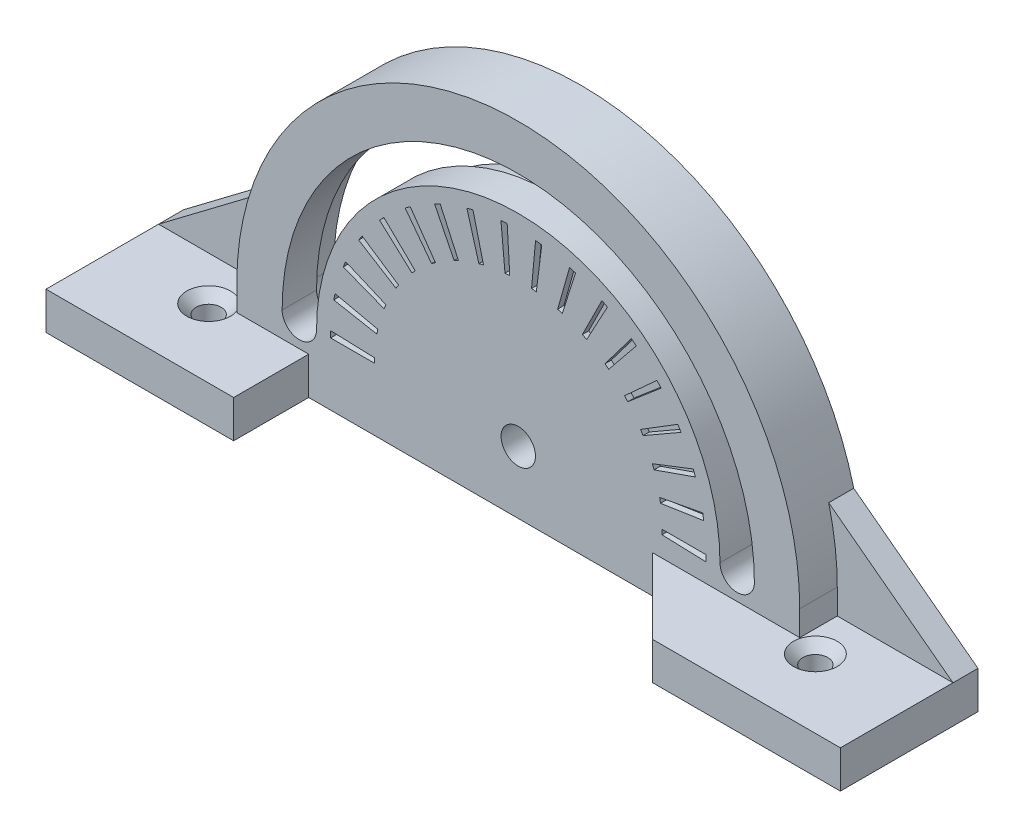
from build123d import *

# Parameters (mm, degrees)
SKETCH1_R                = 2.75
BOSS_EXTRUDE1_DEPTH      = 10
CUT_EXTRUDE1_DEPTH       = 4.5
CUT_EXTRUDE2_DEPTH       = 1
CIRPATTERN1_COUNT        = 18
CIRPATTERN1_ANGLE        = 180
SKETCH4_W                = 30
SKETCH4_H                = 22
SKETCH4_R                = 2
BOSS_EXTRUDE2_DEPTH      = 6
CHAMFER3_SIZE            = 12
BOSS_EXTRUDE3_DEPTH      = 4
CHAMFER4_SIZE            = 1.5
CHAMFER4_OF_MIRROR1_SIZE = 1.5


with BuildPart() as part:
    # Sketch1 → Boss-Extrude1 (new body)
    with BuildSketch(Plane.XY):
        with BuildLine():
            Line((-45, 0), (-45, -10))
            Line((-45, -10), (45, -10))
            Line((45, -10), (45, 0))
            ThreePointArc((45, 0), (0, 45), (-45, 0))
        make_face()
        Circle(SKETCH1_R, mode=Mode.SUBTRACT)
        with BuildLine():
            ThreePointArc((-32.25, 0), (0, 32.25), (32.25, 0))
            ThreePointArc((32.25, 0), (35, -2.75), (37.75, 0))
            ThreePointArc((37.75, 0), (0, 37.75), (-37.75, 0))
            ThreePointArc((-37.75, 0), (-35, -2.75), (-32.25, 0))
        make_face(mode=Mode.SUBTRACT)
    extrude(amount=BOSS_EXTRUDE1_DEPTH)

    # Sketch2 → Cut-Extrude1 (cut)
    with BuildSketch(Plane(origin=(0, 0, 0), x_dir=(-1, 0, 0), z_dir=(0, 0, -1))):
        Polygon((4.907477288, 0), (2.453738644, -4.25), (-2.453738644, -4.25), (-4.907477288, 0), (-2.453738644, 4.25), (2.453738644, 4.25), align=None)
        with BuildLine():
            ThreePointArc((-30.5, 0), (0, 30.5), (30.5, 0))
            ThreePointArc((30.5, 0), (35, -4.5), (39.5, 0))
            ThreePointArc((39.5, 0), (0, 39.5), (-39.5, 0))
            ThreePointArc((-39.5, 0), (-35, -4.5), (-30.5, 0))
        make_face()
    extrude(amount=-CUT_EXTRUDE1_DEPTH, mode=Mode.SUBTRACT)

    # Sketch3 → Cut-Extrude2 (cut)
    with BuildSketch(Plane.XY.offset(10)):
        with BuildLine():
            Line((-29.983333333, 0.999861101), (-22.987222222, 0.766560178))
            ThreePointArc((-22.987222222, 0.766560178), (-22.996805334, 0.383333333), (-23, 0))
            Line((-23, 0), (-30, 0))
            ThreePointArc((-30, 0), (-29.995833044, 0.5), (-29.983333333, 0.999861101))
        make_face()
    cut_extrude2 = extrude(amount=-CUT_EXTRUDE2_DEPTH, mode=Mode.SUBTRACT)

    # CirPattern1: Cut-Extrude2 ×18 about axis
    cirpattern1_axis = Axis((0, 0, 0), (0, 0, -1))
    for i in range(1, CIRPATTERN1_COUNT):
        add(cut_extrude2.rotate(cirpattern1_axis, i * CIRPATTERN1_ANGLE / (CIRPATTERN1_COUNT - 1)), mode=Mode.SUBTRACT)

    # Sketch4 → Boss-Extrude2 (add)
    with BuildSketch(Plane.XZ.offset(10)):
        with Locations((48.5, 11)):
            Rectangle(SKETCH4_W, SKETCH4_H)
        with Locations(Location((48.5, 11, 0), (0, 0, 270))):
            Circle(SKETCH4_R, mode=Mode.SUBTRACT)
    boss_extrude2 = extrude(amount=-BOSS_EXTRUDE2_DEPTH)

    # Chamfer3
    chamfer3_edges = [part.edges().sort_by_distance(p)[0] for p in [
        (33.5, -7, 10),
    ]]
    chamfer(chamfer3_edges, length=CHAMFER3_SIZE - 0.0001)  # a hair under: the kernel refuses the full size

    # Sketch5 → Boss-Extrude3 (add)
    with BuildSketch(Plane(origin=(0, 0, 0), x_dir=(-1, 0, 0), z_dir=(0, 0, -1))):
        Polygon((-63.5, -4), (-43.634848459, 11), (-43.634848459, -4), align=None)
    boss_extrude3 = extrude(amount=-BOSS_EXTRUDE3_DEPTH)

    # Chamfer4
    chamfer4_edges = [part.edges().sort_by_distance(p)[0] for p in [
        (48.5, -4, 13),
    ]]
    chamfer(chamfer4_edges, length=CHAMFER4_SIZE)

    # Mirror1: Boss-Extrude2, Boss-Extrude3 across plane
    add(boss_extrude2.mirror(Plane(origin=(0, 0, 0), x_dir=(0, 0, 1), z_dir=(1, 0, 0))))
    add(boss_extrude3.mirror(Plane(origin=(0, 0, 0), x_dir=(0, 0, 1), z_dir=(1, 0, 0))))

    # Chamfer4 of Mirror1
    chamfer4_of_mirror1_edges = [part.edges().sort_by_distance(p)[0] for p in [
        (-48.5, -4, 13),
    ]]
    chamfer(chamfer4_of_mirror1_edges, length=CHAMFER4_OF_MIRROR1_SIZE)


solid = part.part
